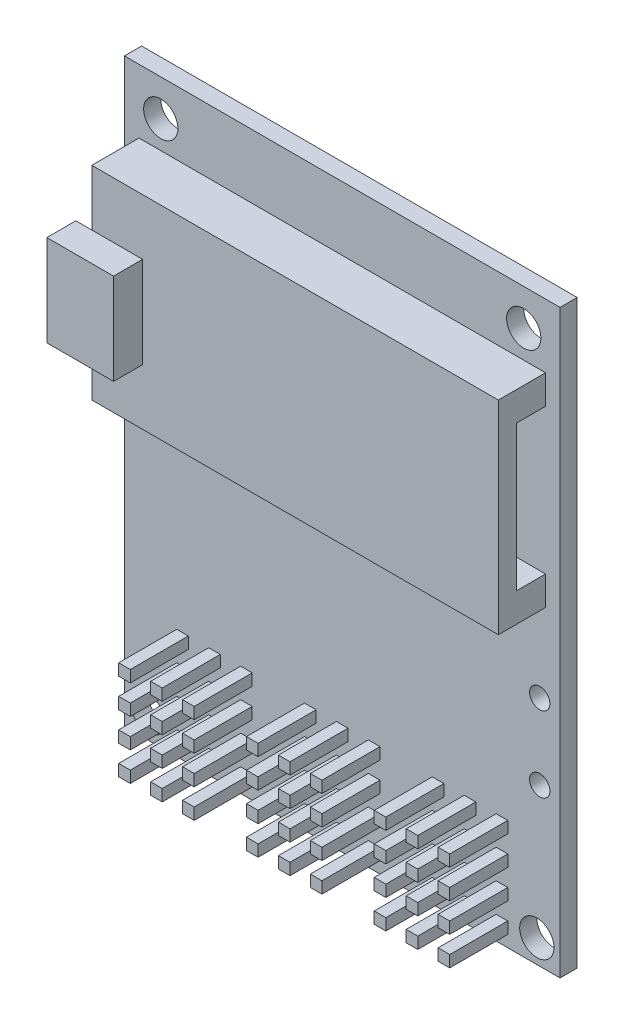
from build123d import *

# Parameters (mm, degrees)
SKETCH1_W           = 38.1
SKETCH1_H           = 50.8
SKETCH1_R           = 1.5
BOSS_EXTRUDE1_DEPTH = 1.5
SKETCH2_R           = 0.889
CUT_EXTRUDE1_DEPTH  = 32.785413321
SKETCH3_W           = 1.016
SKETCH3_H           = 1.016
BOSS_EXTRUDE2_DEPTH = 5.08
BOSS_EXTRUDE3_DEPTH = 2.54
SKETCH6_W           = 35.56
SKETCH6_H           = 17.78
BOSS_EXTRUDE4_DEPTH = 1.5875
BOSS_EXTRUDE5_DEPTH = 2.54


with BuildPart() as part:
    # Sketch1 → Boss-Extrude1 (new body)
    with BuildSketch(Plane.XY):
        Rectangle(SKETCH1_W, SKETCH1_H)
        with Locations((-17.018, -23.368)):
            Circle(SKETCH1_R, mode=Mode.SUBTRACT)
        with Locations((-15.875, 22.225)):
            Circle(SKETCH1_R, mode=Mode.SUBTRACT)
        with Locations((17.018, -23.368)):
            Circle(SKETCH1_R, mode=Mode.SUBTRACT)
        with Locations((15.875, 22.225)):
            Circle(SKETCH1_R, mode=Mode.SUBTRACT)
    extrude(amount=BOSS_EXTRUDE1_DEPTH)

    # Sketch2 → Cut-Extrude1 (cut, through all)
    with BuildSketch(Plane.XY.offset(1.5)):
        with Locations((17.272, -11.684)):
            Circle(SKETCH2_R)
        with Locations((17.272, -5.08)):
            Circle(SKETCH2_R)
    extrude(amount=-CUT_EXTRUDE1_DEPTH, mode=Mode.SUBTRACT)

    # Sketch3 → Boss-Extrude2 (add)
    with BuildSketch(Plane.XY.offset(1.5)):
        with Locations((-13.97, -23.876)):
            Rectangle(SKETCH3_W, SKETCH3_H)
        with Locations((-13.97, -21.336)):
            Rectangle(SKETCH3_W, SKETCH3_H)
        with Locations((-13.97, -18.796)):
            Rectangle(SKETCH3_W, SKETCH3_H)
        with Locations((-13.97, -16.256)):
            Rectangle(SKETCH3_W, SKETCH3_H)
        with Locations((-11.176, -23.876)):
            Rectangle(SKETCH3_W, SKETCH3_H)
        with Locations((-11.176, -21.336)):
            Rectangle(SKETCH3_W, SKETCH3_H)
        with Locations((-11.176, -18.796)):
            Rectangle(SKETCH3_W, SKETCH3_H)
        with Locations((-11.176, -16.256)):
            Rectangle(SKETCH3_W, SKETCH3_H)
        with Locations((-8.382, -23.876)):
            Rectangle(SKETCH3_W, SKETCH3_H)
        with Locations((-8.382, -21.336)):
            Rectangle(SKETCH3_W, SKETCH3_H)
        with Locations((-8.382, -18.796)):
            Rectangle(SKETCH3_W, SKETCH3_H)
        with Locations((-8.382, -16.256)):
            Rectangle(SKETCH3_W, SKETCH3_H)
        with Locations((-2.794, -23.876)):
            Rectangle(SKETCH3_W, SKETCH3_H)
        with Locations((-2.794, -21.336)):
            Rectangle(SKETCH3_W, SKETCH3_H)
        with Locations((-2.794, -18.796)):
            Rectangle(SKETCH3_W, SKETCH3_H)
        with Locations((-2.794, -16.256)):
            Rectangle(SKETCH3_W, SKETCH3_H)
        with Locations((0, -23.876)):
            Rectangle(SKETCH3_W, SKETCH3_H)
        with Locations((0, -21.336)):
            Rectangle(SKETCH3_W, SKETCH3_H)
        with Locations((0, -18.796)):
            Rectangle(SKETCH3_W, SKETCH3_H)
        with Locations((0, -16.256)):
            Rectangle(SKETCH3_W, SKETCH3_H)
        with Locations((2.794, -23.876)):
            Rectangle(SKETCH3_W, SKETCH3_H)
        with Locations((2.794, -21.336)):
            Rectangle(SKETCH3_W, SKETCH3_H)
        with Locations((2.794, -18.796)):
            Rectangle(SKETCH3_W, SKETCH3_H)
        with Locations((2.794, -16.256)):
            Rectangle(SKETCH3_W, SKETCH3_H)
        with Locations((8.382, -23.876)):
            Rectangle(SKETCH3_W, SKETCH3_H)
        with Locations((8.382, -21.336)):
            Rectangle(SKETCH3_W, SKETCH3_H)
        with Locations((8.382, -18.796)):
            Rectangle(SKETCH3_W, SKETCH3_H)
        with Locations((8.382, -16.256)):
            Rectangle(SKETCH3_W, SKETCH3_H)
        with Locations((11.176, -23.876)):
            Rectangle(SKETCH3_W, SKETCH3_H)
        with Locations((11.176, -21.336)):
            Rectangle(SKETCH3_W, SKETCH3_H)
        with Locations((11.176, -18.796)):
            Rectangle(SKETCH3_W, SKETCH3_H)
        with Locations((11.176, -16.256)):
            Rectangle(SKETCH3_W, SKETCH3_H)
        with Locations((13.97, -23.876)):
            Rectangle(SKETCH3_W, SKETCH3_H)
        with Locations((13.97, -21.336)):
            Rectangle(SKETCH3_W, SKETCH3_H)
        with Locations((13.97, -18.796)):
            Rectangle(SKETCH3_W, SKETCH3_H)
        with Locations((13.97, -16.256)):
            Rectangle(SKETCH3_W, SKETCH3_H)
    extrude(amount=BOSS_EXTRUDE2_DEPTH)

    # Sketch5 → Boss-Extrude3 (add)
    with BuildSketch(Plane.XY.offset(1.5)):
        Polygon((17.78, 19.812), (17.78, 17.272), (15.24, 17.272), (-15.24, 17.272), (-15.24, 4.572), (15.24, 4.572), (17.78, 4.572), (17.78, 2.032), (-17.78, 2.032), (-17.78, 19.812), align=None)
    extrude(amount=BOSS_EXTRUDE3_DEPTH)

    # Sketch6 → Boss-Extrude4 (add)
    with BuildSketch(Plane.XY.offset(4.04)):
        with Locations((0, 10.922)):
            Rectangle(SKETCH6_W, SKETCH6_H)
    extrude(amount=BOSS_EXTRUDE4_DEPTH)

    # Sketch7 → Boss-Extrude5 (add)
    with BuildSketch(Plane.XY.offset(5.6275)):
        Polygon((-17.78, 14.9098), (-19.177, 14.9098), (-19.177, 6.9342), (-17.78, 6.9342), (-13.335, 6.9342), (-13.335, 14.9098), align=None)
    extrude(amount=BOSS_EXTRUDE5_DEPTH)


solid = part.part
